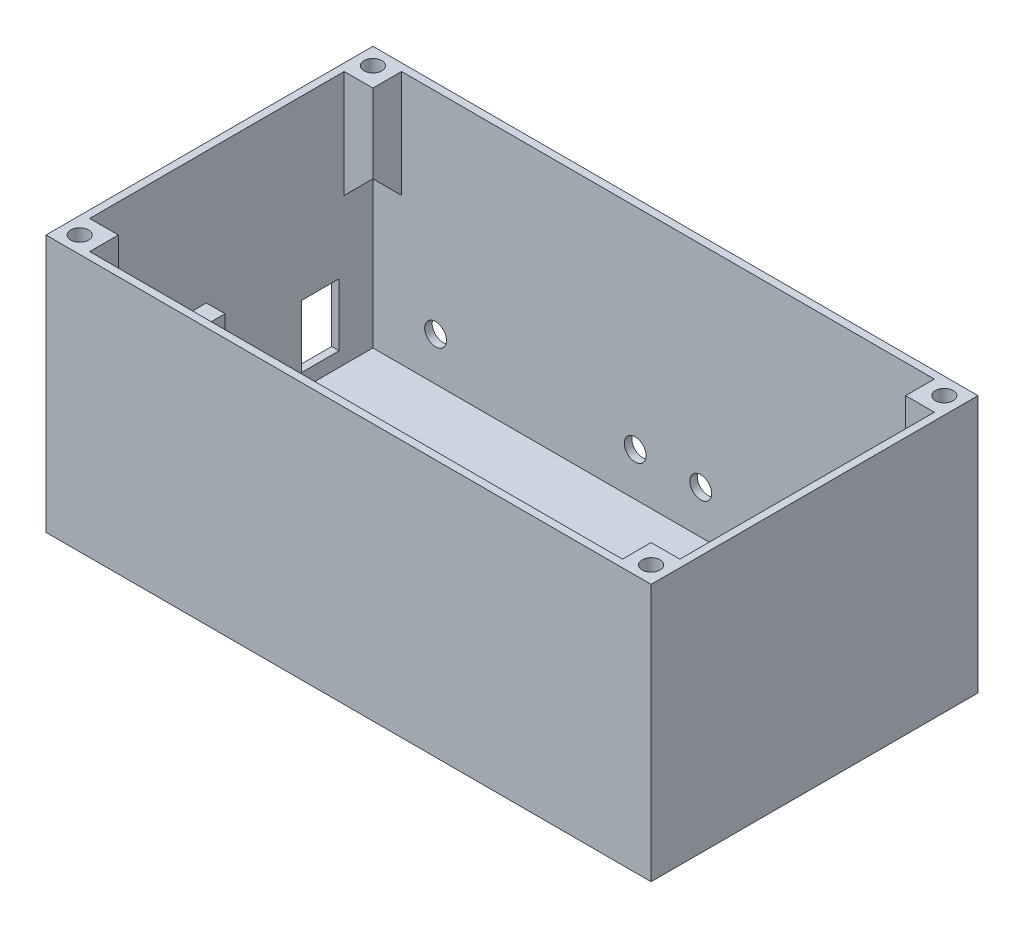
from build123d import *

# Parameters (mm, degrees)
SKIZZE1_W                       = 97
SKIZZE1_H                       = 41.280710538
AUFSATZ_LINEAR_AUSTRAGEN1_DEPTH = 1.2
AUFSATZ_LINEAR_AUSTRAGEN2_DEPTH = 50
SKIZZE3_W                       = 23.3
SKIZZE3_H                       = 19.6
SKIZZE3_W_2                     = 16.4
SKIZZE3_H_2                     = 14.8
AUFSATZ_LINEAR_AUSTRAGEN3_DEPTH = 3
SKIZZE3_2_W                     = 16.4
SKIZZE3_2_H                     = 14.8
SCHNITT_LINEAR_AUSTRAGEN1_DEPTH = 117.203171482
SKIZZE5_W                       = 97
SKIZZE5_H                       = 41.280710538
AUFSATZ_LINEAR_AUSTRAGEN4_DEPTH = 1.2
SKIZZE7_W                       = 4.6
SKIZZE7_H                       = 4.6
SKIZZE7_R                       = 1.425
AUFSATZ_LINEAR_AUSTRAGEN5_DEPTH = 12
SKIZZE8_R                       = 1.75
SCHNITT_LINEAR_AUSTRAGEN3_DEPTH = 12
SKIZZE9_W                       = 6
SKIZZE9_H                       = 10
SCHNITT_LINEAR_AUSTRAGEN4_DEPTH = 12
SKIZZE10_W                      = 4.6
SKIZZE10_H                      = 4.6
AUFSATZ_LINEAR_AUSTRAGEN6_DEPTH = 0.6
FASE1_SIZE                      = 4.6


with BuildPart() as part:
    # Skizze1 → Aufsatz-Linear austragen1 (new body)
    with BuildSketch(Plane.XY):
        with Locations((48.5, 20.640355269)):
            Rectangle(SKIZZE1_W, SKIZZE1_H)
    extrude(amount=AUFSATZ_LINEAR_AUSTRAGEN1_DEPTH)

    # Skizze2 → Aufsatz-Linear austragen2 (add)
    with BuildSketch(Plane.XY.offset(1.2)):
        Polygon((0, 41.280710538), (0, 0), (48.5, 0), (97, 0), (97, 41.280710538), (95.8, 41.280710538), (95.8, 0.6), (1.2, 0.6), (1.2, 41.280710538), align=None)
    extrude(amount=AUFSATZ_LINEAR_AUSTRAGEN2_DEPTH)

    # Skizze3 → Aufsatz-Linear austragen3 (add)
    with BuildSketch(Plane(origin=(1.2, 0, 0), x_dir=(0, 0, -1), z_dir=(1, 0, 0))):
        with Locations((-39.55, 10.4)):
            Rectangle(SKIZZE3_W, SKIZZE3_H)
        with Locations((-39.1, 9.8)):
            Rectangle(SKIZZE3_W_2, SKIZZE3_H_2, mode=Mode.SUBTRACT)
    extrude(amount=AUFSATZ_LINEAR_AUSTRAGEN3_DEPTH)

    # Skizze3<2> → Schnitt-Linear austragen1 (cut, through all)
    with BuildSketch(Plane(origin=(1.2, 0, 0), x_dir=(0, 0, -1), z_dir=(1, 0, 0))):
        with Locations((-39.1, 9.8)):
            Rectangle(SKIZZE3_2_W, SKIZZE3_2_H)
    extrude(amount=-SCHNITT_LINEAR_AUSTRAGEN1_DEPTH, mode=Mode.SUBTRACT)

    # Skizze5 → Aufsatz-Linear austragen4 (add)
    with BuildSketch(Plane.XY.offset(51.2)):
        with Locations((48.5, 20.640355269)):
            Rectangle(SKIZZE5_W, SKIZZE5_H)
    extrude(amount=AUFSATZ_LINEAR_AUSTRAGEN4_DEPTH)

    # Skizze7 → Aufsatz-Linear austragen5 (add)
    # profile 1 of 4: a face of its own
    with BuildSketch(Plane(origin=(0, 41.280710538, 0), x_dir=(1, 0, 0), z_dir=(0, 1, 0))):
        with Locations((3.5, -3.5)):
            Rectangle(SKIZZE7_W, SKIZZE7_H)
        with Locations(Location((2.7, -2.7, 0), (0, 0, 270))):
            Circle(SKIZZE7_R, mode=Mode.SUBTRACT)
    # profile 2 of 4: a face of its own
    with BuildSketch(Plane(origin=(0, 41.280710538, 0), x_dir=(1, 0, 0), z_dir=(0, 1, 0))):
        with Locations((93.5, -3.5)):
            Rectangle(SKIZZE7_W, SKIZZE7_H)
        with Locations(Location((94.3, -2.7, 0), (0, 0, 90))):
            Circle(SKIZZE7_R, mode=Mode.SUBTRACT)
    # profile 3 of 4: a face of its own
    with BuildSketch(Plane(origin=(0, 41.280710538, 0), x_dir=(1, 0, 0), z_dir=(0, 1, 0))):
        with Locations((93.5, -48.9)):
            Rectangle(SKIZZE7_W, SKIZZE7_H)
        with Locations(Location((94.3, -49.7, 0), (0, 0, 270))):
            Circle(SKIZZE7_R, mode=Mode.SUBTRACT)
    # profile 4 of 4: a face of its own
    with BuildSketch(Plane(origin=(0, 41.280710538, 0), x_dir=(1, 0, 0), z_dir=(0, 1, 0))):
        with Locations((3.5, -48.9)):
            Rectangle(SKIZZE7_W, SKIZZE7_H)
        with Locations(Location((2.7, -49.7, 0), (0, 0, 90))):
            Circle(SKIZZE7_R, mode=Mode.SUBTRACT)
    extrude(amount=-AUFSATZ_LINEAR_AUSTRAGEN5_DEPTH)

    # Skizze8 → Schnitt-Linear austragen3 (cut)
    with BuildSketch(Plane.XY.offset(1.2)):
        with Locations((11.25, 7.530710538)):
            Circle(SKIZZE8_R)
        with Locations((43.25, 7.530710538)):
            Circle(SKIZZE8_R)
        with Locations((53.75, 7.530710538)):
            Circle(SKIZZE8_R)
        with Locations((85.75, 7.530710538)):
            Circle(SKIZZE8_R)
    extrude(amount=-SCHNITT_LINEAR_AUSTRAGEN3_DEPTH, mode=Mode.SUBTRACT)

    # Skizze9 → Schnitt-Linear austragen4 (cut)
    with BuildSketch(Plane.ZY):
        with Locations((9.605096132, 7.910310386)):
            Rectangle(SKIZZE9_W, SKIZZE9_H)
    extrude(amount=-SCHNITT_LINEAR_AUSTRAGEN4_DEPTH, mode=Mode.SUBTRACT)

    # Skizze10 → Aufsatz-Linear austragen6 (add)
    with BuildSketch(Plane.XZ.offset(-29.280710538)):
        with Locations((3.5, 48.9)):
            Rectangle(SKIZZE10_W, SKIZZE10_H)
        with Locations((3.5, 3.5)):
            Rectangle(SKIZZE10_W, SKIZZE10_H)
        with Locations((93.5, 48.9)):
            Rectangle(SKIZZE10_W, SKIZZE10_H)
        with Locations((93.5, 3.5)):
            Rectangle(SKIZZE10_W, SKIZZE10_H)
    extrude(amount=AUFSATZ_LINEAR_AUSTRAGEN6_DEPTH)

    # Fase1
    fase1_edges = [part.edges().sort_by_distance(p)[0] for p in [
        (1.2, 28.680710538, 3.5),
        (3.5, 28.680710538, 1.2),
        (93.5, 28.680710538, 1.2),
        (95.8, 28.680710538, 3.5),
        (95.8, 28.680710538, 48.9),
        (93.5, 28.680710538, 51.2),
        (1.2, 28.680710538, 48.9),
        (3.5, 28.680710538, 51.2),
    ]]
    chamfer(fase1_edges, length=FASE1_SIZE - 0.0001)  # a hair under: the kernel refuses the full size


solid = part.part
